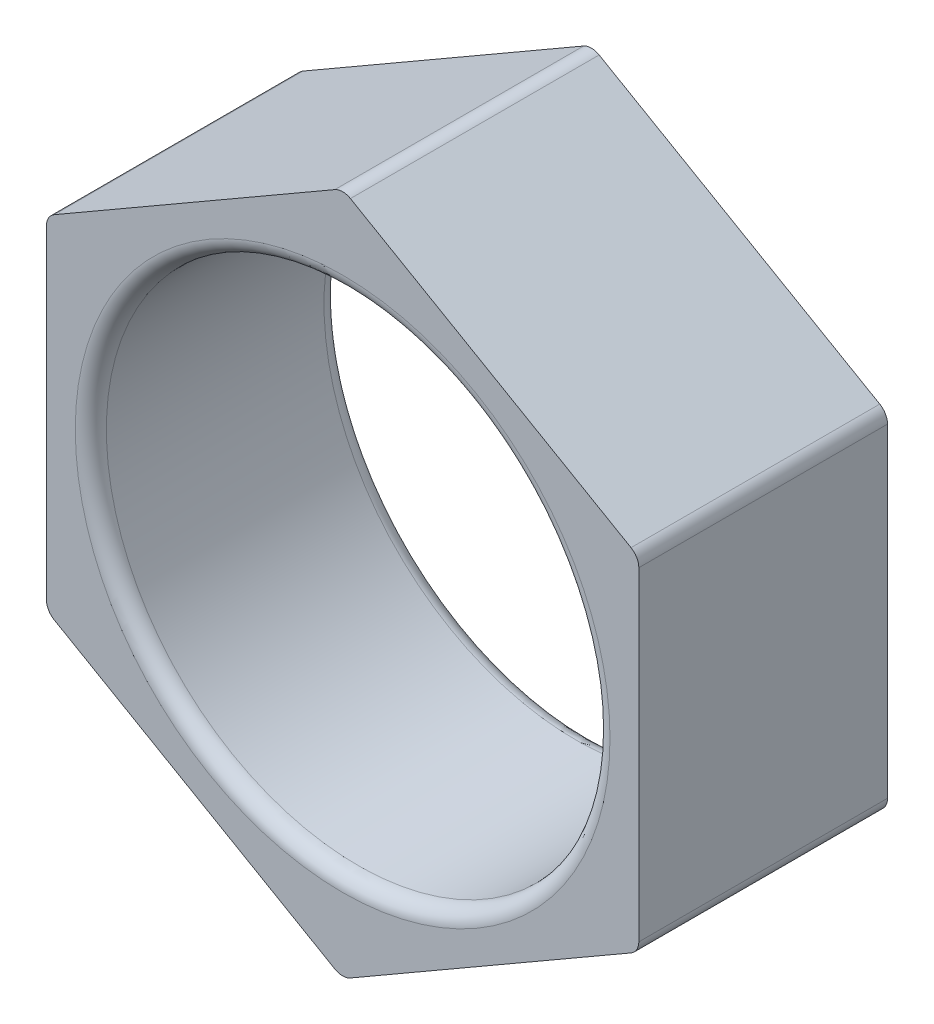
from build123d import *

# Parameters (mm, degrees)
BOSS_EXTRUDE1_DEPTH = 4
SKETCH2_R           = 4.05
CUT_EXTRUDE1_DEPTH  = 9.302860953
FILLET1_R           = 0.25


with BuildPart() as part:
    # Sketch1 → Boss-Extrude1 (new body)
    with BuildSketch(Plane.XY):
        Polygon((0, 5.5), (-4.763139721, 2.75), (-4.763139721, -2.75), (0, -5.5), (4.763139721, -2.75), (4.763139721, 2.75), align=None)
    extrude(amount=BOSS_EXTRUDE1_DEPTH)

    # Sketch2 → Cut-Extrude1 (cut, through all)
    with BuildSketch(Plane.XY.offset(4)):
        Circle(SKETCH2_R)
    extrude(amount=-CUT_EXTRUDE1_DEPTH, mode=Mode.SUBTRACT)

    # Fillet1
    fillet1_edges = [part.edges().sort_by_distance(p)[0] for p in [
        (-4.05, 0, 4),
        (-4.05, 0, 0),
        (-4.763139721, 2.75, 2),
        (-4.763139721, -2.75, 2),
        (0, -5.5, 2),
        (4.763139721, -2.75, 2),
        (4.763139721, 2.75, 2),
        (0, 5.5, 2),
    ]]
    fillet(fillet1_edges, radius=FILLET1_R)


solid = part.part
